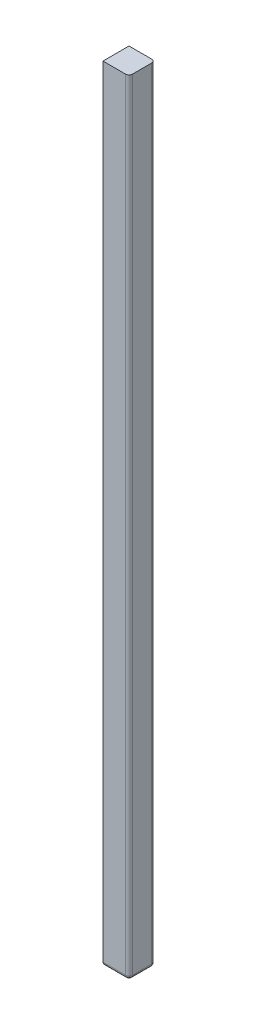
from build123d import *

# Parameters (mm, degrees)
SKETCH1_W           = 3.8
SKETCH1_H           = 3.8
BOSS_EXTRUDE1_DEPTH = 114.3
FILLET1_R           = 0.5
FILLET2_R           = 0.5


with BuildPart() as part:
    # Sketch1 → Boss-Extrude1 (new body)
    with BuildSketch(Plane(origin=(0, 0, 0), x_dir=(1, 0, 0), z_dir=(0, 1, 0))):
        Rectangle(SKETCH1_W, SKETCH1_H)
    extrude(amount=BOSS_EXTRUDE1_DEPTH)

    # Fillet1
    fillet1_edges = [part.edges().sort_by_distance(p)[0] for p in [
        (0, 0, 1.9),
        (-1.9, 0, 0),
        (0, 0, -1.9),
        (1.9, 0, 0),
    ]]
    fillet(fillet1_edges, radius=FILLET1_R)

    # Fillet2
    # the kernel refuses this fillet: 0.5 mm, written as the material it takes off along each edge
    with BuildSketch(Plane(origin=(1.4, 0.5, -1.4), x_dir=(0, 0, -1), z_dir=(1, 0, 0))) as fillet2_piece_1_section:
        Polygon((0, 0), (FILLET2_R, 0), (FILLET2_R, -FILLET2_R), (0, -FILLET2_R), align=None)
    fillet2_piece_1 = extrude(amount=FILLET2_R, mode=Mode.PRIVATE)
    fillet2_piece_1 = fillet2_piece_1 - Plane(origin=(1.4, 0.5, -1.4), x_dir=(0, 0.7071067811865475, 0.7071067811865475), z_dir=(1, 0, 0)) * Sphere(FILLET2_R, mode=Mode.PRIVATE)
    add(fillet2_piece_1, mode=Mode.SUBTRACT)
    with BuildSketch(Plane(origin=(1.4, 0.5, 1.4), x_dir=(1, 0, 0), z_dir=(0, 0, 1))) as fillet2_piece_2_section:
        Polygon((0, 0), (FILLET2_R, 0), (FILLET2_R, -FILLET2_R), (0, -FILLET2_R), align=None)
    fillet2_piece_2 = extrude(amount=FILLET2_R, mode=Mode.PRIVATE)
    fillet2_piece_2 = fillet2_piece_2 - Plane(origin=(1.4, 0.5, 1.4), x_dir=(-0.7071067811865475, 0.7071067811865475, 0), z_dir=(0, 0, 1)) * Sphere(FILLET2_R, mode=Mode.PRIVATE)
    add(fillet2_piece_2, mode=Mode.SUBTRACT)
    with BuildSketch(Plane(origin=(1.9, 0.5, 1.9), x_dir=(-1, 0, 0), z_dir=(0, 1, 0)), Plane(origin=(1.9, 0.5, -1.9), x_dir=(0, 0, 1), z_dir=(0, 1, 0))) as fillet2_piece_3:
        with BuildLine():
            CenterArc((FILLET2_R, -FILLET2_R), FILLET2_R, 90, 90)
            Line((0, -FILLET2_R), (0, 0))
            Line((0, 0), (FILLET2_R, 0))
        make_face()
    extrude(amount=115.05, mode=Mode.SUBTRACT)


solid = part.part
